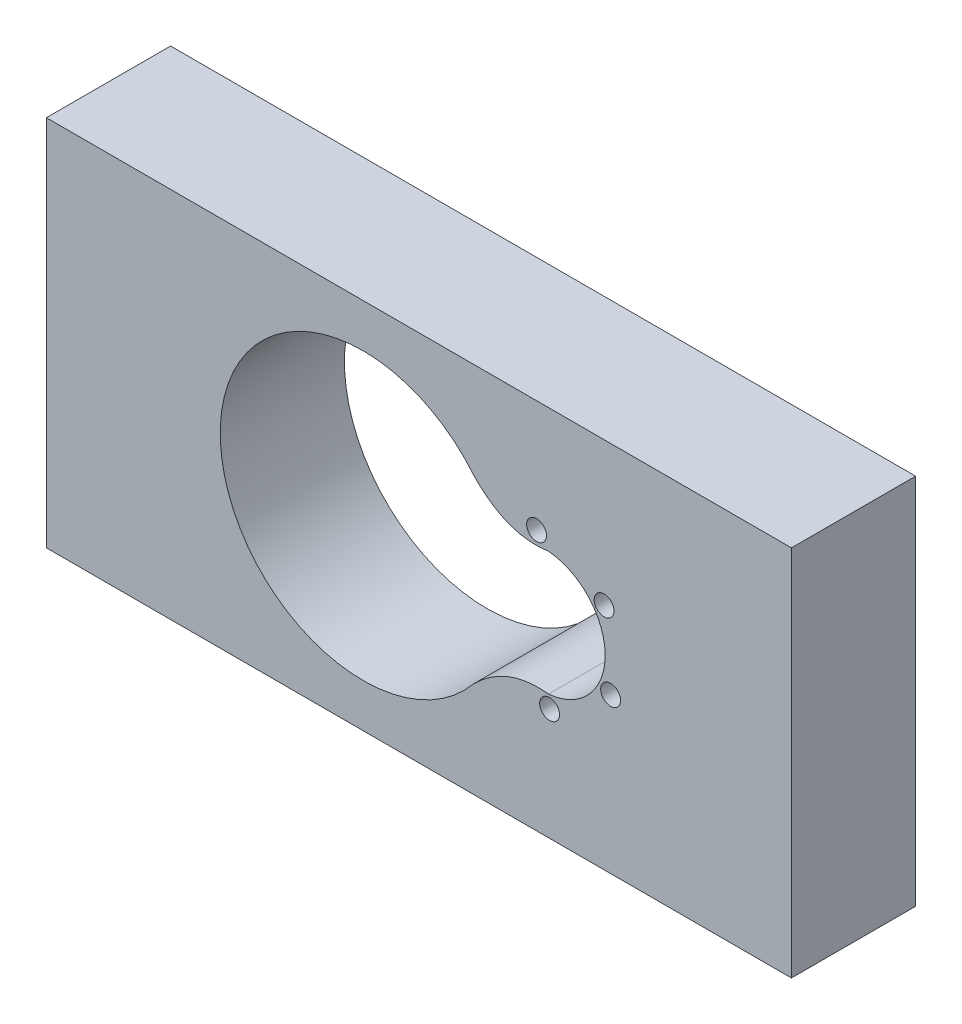
from build123d import *

# Parameters (mm, degrees)
ESQUISSE1_W             = 60
ESQUISSE1_H             = 30
BOSS_EXTRU_1_DEPTH      = 10
ESQUISSE2_R             = 0.8
ENL_V_MAT_EXTRU_1_DEPTH = 68.823299831


with BuildPart() as part:
    # Esquisse1 → Boss.-Extru.1 (new body)
    with BuildSketch(Plane.XY):
        with Locations((30, 15)):
            Rectangle(ESQUISSE1_W, ESQUISSE1_H)
    extrude(amount=BOSS_EXTRU_1_DEPTH)

    # Esquisse2 → Enlèv. mat.-Extru.1 (cut, through all)
    with BuildSketch(Plane.XY.offset(10)):
        with Locations((39.474554028, 20.976947928)):
            Circle(ESQUISSE2_R)
        with Locations((44.913465757, 18.443523524)):
            Circle(ESQUISSE2_R)
        with Locations((45.438911728, 12.466575596)):
            Circle(ESQUISSE2_R)
        with Locations((40.525445972, 9.023052072)):
            Circle(ESQUISSE2_R)
        with BuildLine():
            ThreePointArc((40.440833126, 19.980528702), (44.999999999, 14.99988924), (40.440612467, 10.019451772))
            add(Edge.make_bspline(
                [(34.376111445, 7.688047757), (37.075642985, 10.409987136), (40.440612467, 10.019451772)],
                knots=[0, 0, 0, 1, 1, 1], degree=2))
            ThreePointArc((34.376111445, 7.688047757), (14.000009417, 14.985282816), (34.35736737, 22.334646773))
            add(Edge.make_bspline(
                [(34.35736737, 22.334646773), (37.032041351, 19.458525566), (40.440833126, 19.980528702)],
                knots=[0, 0, 0, 1, 1, 1], degree=2))
        make_face()
    extrude(amount=-ENL_V_MAT_EXTRU_1_DEPTH, mode=Mode.SUBTRACT)


solid = part.part
